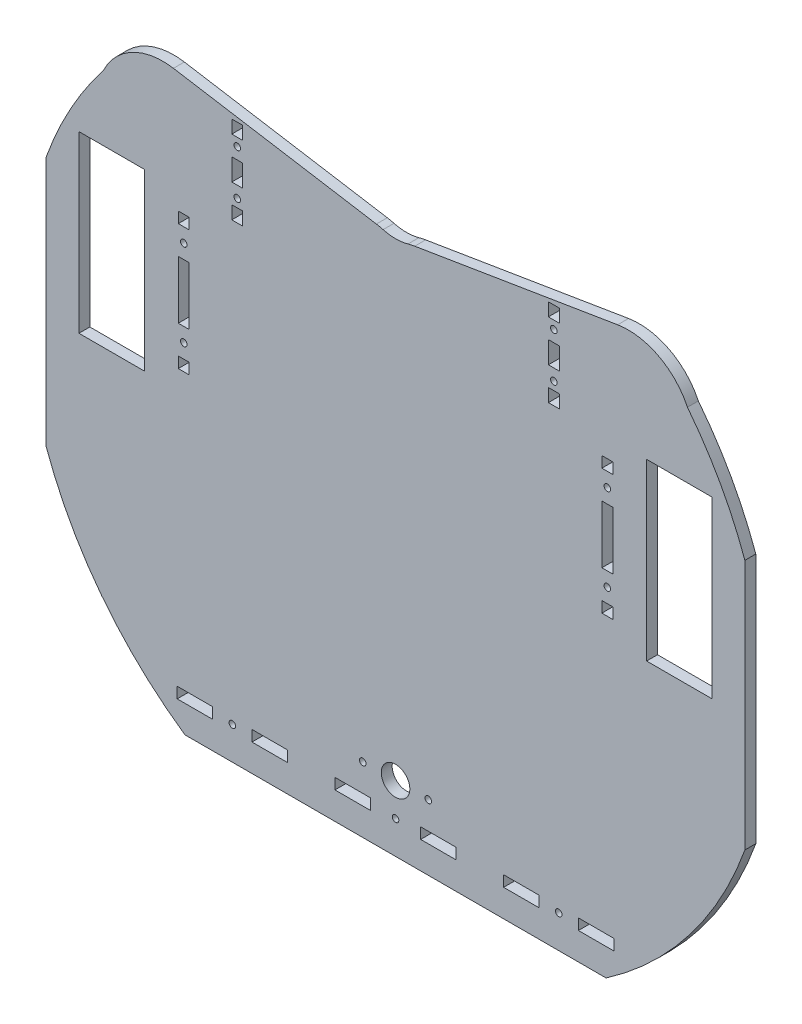
from build123d import *

# Parameters (mm, degrees)
SKETCH1_W           = 30
SKETCH1_H           = 80
BOSS_EXTRUDE1_DEPTH = 5
SKETCH2_W           = 5
SKETCH2_H           = 26.5
SKETCH2_H_2         = 5
SKETCH2_R           = 1.5
CUT_EXTRUDE1_DEPTH  = 5
BOSS_EXTRUDE2_DEPTH = 5
FILLET1_R           = 30
SKETCH5_R           = 6.55
SKETCH5_R_2         = 1.5
CUT_EXTRUDE2_DEPTH  = 5
SKETCH6_W           = 16.25
SKETCH6_H           = 5
SKETCH6_R           = 1.5
CUT_EXTRUDE3_DEPTH  = 10
SKETCH7_W           = 5
SKETCH7_H           = 5.5
SKETCH7_H_2         = 10
SKETCH7_H_3         = 6
SKETCH7_R           = 1.5
CUT_EXTRUDE4_DEPTH  = 10
SKETCH8_W           = 5.078430198
SKETCH8_H           = 27.315407993
SKETCH8_W_2         = 5
SKETCH8_H_2         = 26.5
BOSS_EXTRUDE4_DEPTH = 5


with BuildPart() as part:
    # Sketch1 → Boss-Extrude1 (new body)
    with BuildSketch(Plane.XY):
        with BuildLine():
            Line((133.697419571, 70), (-133.697419571, 70))
            ThreePointArc((-133.697419571, 70), (-148.761211935, 47.280628484), (-160, 22.445626465))
            Line((-160, 22.445626465), (-160, -92.445626465))
            ThreePointArc((-160, -92.445626465), (-134.69865165, -138.712454622), (-96.43650761, -175))
            Line((-96.43650761, -175), (96.43650761, -175))
            ThreePointArc((96.43650761, -175), (134.69865165, -138.712454622), (160, -92.445626465))
            Line((160, -92.445626465), (160, 22.445626465))
            ThreePointArc((160, 22.445626465), (148.761211935, 47.280628484), (133.697419571, 70))
        make_face()
        with Locations((-130, 0)):
            Rectangle(SKETCH1_W, SKETCH1_H, mode=Mode.SUBTRACT)
        with Locations((130, 0)):
            Rectangle(SKETCH1_W, SKETCH1_H, mode=Mode.SUBTRACT)
    extrude(amount=BOSS_EXTRUDE1_DEPTH)

    # Sketch2 → Cut-Extrude1 (cut)
    with BuildSketch(Plane.XY.offset(5)):
        with Locations((-97, 0)):
            Rectangle(SKETCH2_W, SKETCH2_H)
        with Locations((-97, 28.75)):
            Rectangle(SKETCH2_W, SKETCH2_H_2)
        with Locations((-97, -28.75)):
            Rectangle(SKETCH2_W, SKETCH2_H_2)
        with Locations((-97, -19.75)):
            Circle(SKETCH2_R)
        with Locations((-97, 19.75)):
            Circle(SKETCH2_R)
    cut_extrude1 = extrude(amount=-CUT_EXTRUDE1_DEPTH, mode=Mode.SUBTRACT)

    # Mirror1: Cut-Extrude1 across plane
    add(cut_extrude1.mirror(Plane(origin=(0, 0, 0), x_dir=(0, 0, 1), z_dir=(1, 0, 0))), mode=Mode.SUBTRACT)

    # Sketch3 → Boss-Extrude2 (add)
    with BuildSketch(Plane.XY.offset(5)):
        with BuildLine():
            ThreePointArc((-2.08e-07, 70), (-3.490893846, 70.285296133), (-6.889142051, 71.133612942))
            Line((-6.889142051, 71.133612942), (-133.697419571, 92))
            Line((-133.697419571, 92), (-133.697419571, 70))
            Line((-133.697419571, 70), (-2.08e-07, 70))
        make_face()
        with BuildLine():
            ThreePointArc((6.889142051, 71.133612942), (3.49089364, 70.285296099), (-2.08e-07, 70))
            Line((-2.08e-07, 70), (133.697419571, 70))
            Line((133.697419571, 70), (133.697419571, 92))
            Line((133.697419571, 92), (6.889142051, 71.133612942))
        make_face()
    extrude(amount=-BOSS_EXTRUDE2_DEPTH)

    # Fillet1
    # the kernel refuses this fillet: 30 mm, written as the material it takes off along each edge
    with BuildSketch(Plane(origin=(-6.889142051, 71.133612942, 9.806082425), x_dir=(-0.9867304131972112, 0.16236715083926523, 0), z_dir=(0, 0, -1))) as fillet1_piece_1:
        with BuildLine():
            CenterArc((1.92243297, -30), FILLET1_R, 90, 6.03368508)
            Line((-1.230961232, -0.166191912), (-1.294029116, 0.430484249))
            ThreePointArc((-1.294029116, 0.430484249), (-0.694557768, 0.502617916), (-0.097420291, 0.592038248))
            Line((-0.097420291, 0.592038248), (0, 0.6))
            Line((0, 0.6), (1.92243297, 0.6))
            Line((1.92243297, 0.6), (1.92243297, 0))
        make_face()
    extrude(amount=14.612164849, mode=Mode.SUBTRACT)
    with BuildSketch(Plane(origin=(6.889142051, 71.133612942, 9.806082425), x_dir=(-0.9561345473491755, -0.29292785351582257, 0), z_dir=(0, 0, -1))) as fillet1_piece_2:
        with BuildLine():
            CenterArc((2.108731211, -29.987480741), FILLET1_R, 91.655317917, 6.03368508)
            Line((-1.905148179, -0.257213803), (-1.985425767, 0.337391536))
            Line((-1.985425767, 0.337391536), (-0.080277588, 0.594605339))
            Line((-0.080277588, 0.594605339), (0.017332037, 0.599749615))
            ThreePointArc((0.017332037, 0.599749615), (0.621064672, 0.591027865), (1.224797306, 0.599749615))
            Line((1.224797306, 0.599749615), (1.242129344, 0))
        make_face()
    extrude(amount=14.612164849, mode=Mode.SUBTRACT)
    with BuildSketch(Plane(origin=(133.697419571, 92, 86.008444254), x_dir=(-0.9867304131972118, -0.16236715083926206, 0), z_dir=(0, 0, -1))) as fillet1_piece_3:
        with BuildLine():
            CenterArc((32.403377702, -30), FILLET1_R, 90, 73.954674896)
            Line((3.572077318, -21.70806909), (2.995451311, -21.542230472))
            ThreePointArc((2.995451311, -21.542230472), (1.194000411, -10.951454836), (-0.592038248, -0.097420291))
            Line((-0.592038248, -0.097420291), (0, 0.6))
            Line((0, 0.6), (32.403377702, 0.6))
            Line((32.403377702, 0.6), (32.403377702, 0))
        make_face()
    extrude(amount=167.016888509, mode=Mode.SUBTRACT)
    with BuildSketch(Plane(origin=(-133.697419571, 92, 86.008444254), x_dir=(0, -1, 0), z_dir=(0, 0, -1))) as fillet1_piece_4:
        with BuildLine():
            CenterArc((34.863156511, -27.102383743), FILLET1_R, 115.389646017, 73.954674896)
            Line((5.261244115, -31.973398269), (4.669205867, -32.070818559))
            Line((4.669205867, -32.070818559), (-0.592038248, -0.097420291))
            Line((-0.592038248, -0.097420291), (0, 0.6))
            ThreePointArc((0, 0.6), (11, 0.6), (21.74273687, 0.542047675))
            Line((21.74273687, 0.542047675), (22, 0))
        make_face()
    extrude(amount=167.016888509, mode=Mode.SUBTRACT)

    # Sketch5 → Cut-Extrude2 (cut)
    with BuildSketch(Plane.XY.offset(5)):
        with Locations((0, -145)):
            Circle(SKETCH5_R)
        with Locations((15, -145)):
            Circle(SKETCH5_R_2)
        with Locations((-15, -145)):
            Circle(SKETCH5_R_2)
    extrude(amount=-CUT_EXTRUDE2_DEPTH, mode=Mode.SUBTRACT)

    # Sketch6 → Cut-Extrude3 (cut)
    with BuildSketch(Plane.XY.offset(5)):
        with Locations((-91.875, -160)):
            Rectangle(SKETCH6_W, SKETCH6_H)
        with Locations((-57.625, -160)):
            Rectangle(SKETCH6_W, SKETCH6_H)
        with Locations((-19.625, -160)):
            Rectangle(SKETCH6_W, SKETCH6_H)
        with Locations((19.625, -160)):
            Rectangle(SKETCH6_W, SKETCH6_H)
        with Locations((57.625, -160)):
            Rectangle(SKETCH6_W, SKETCH6_H)
        with Locations((91.875, -160)):
            Rectangle(SKETCH6_W, SKETCH6_H)
        with Locations((0, -160)):
            Circle(SKETCH6_R)
        with Locations((-74.75, -160)):
            Circle(SKETCH6_R)
        with Locations((74.75, -160)):
            Circle(SKETCH6_R)
    extrude(amount=-CUT_EXTRUDE3_DEPTH, mode=Mode.SUBTRACT)

    # Sketch7 → Cut-Extrude4 (cut)
    with BuildSketch(Plane.XY.offset(5)):
        with Locations((-37.5, 69.75)):
            Rectangle(SKETCH7_W, SKETCH7_H)
        with Locations((-37.5, 51)):
            Rectangle(SKETCH7_W, SKETCH7_H_2)
        with Locations((-72.5, 60)):
            Rectangle(SKETCH7_W, SKETCH7_H_2)
        with Locations((-72.5, 77)):
            Rectangle(SKETCH7_W, SKETCH7_H_3)
        with Locations((-72.5, 43)):
            Rectangle(SKETCH7_W, SKETCH7_H_3)
        with Locations((-37.5, 62.5)):
            Circle(SKETCH7_R)
        with Locations((-72.5, 70.25)):
            Circle(SKETCH7_R)
        with Locations((-72.5, 49.75)):
            Circle(SKETCH7_R)
    cut_extrude4 = extrude(amount=-CUT_EXTRUDE4_DEPTH, mode=Mode.SUBTRACT)

    # Mirror2: Cut-Extrude4 across plane
    add(cut_extrude4.mirror(Plane(origin=(0, 0, 0), x_dir=(0, 0, 1), z_dir=(1, 0, 0))), mode=Mode.SUBTRACT)

    # Sketch8 → Boss-Extrude4 (add)
    with BuildSketch(Plane.XY.offset(5)):
        with Locations((-37.539215099, 59.657703997)):
            Rectangle(SKETCH8_W, SKETCH8_H)
        with Locations((37.5, 59.25)):
            Rectangle(SKETCH8_W_2, SKETCH8_H_2)
    extrude(amount=-BOSS_EXTRUDE4_DEPTH)


solid = part.part
